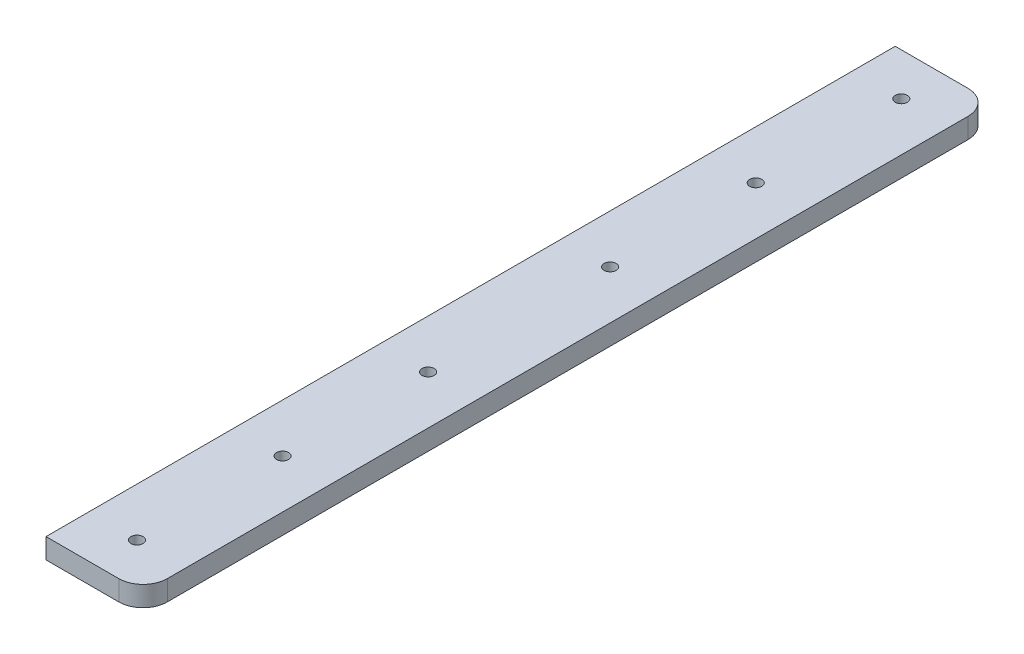
from build123d import *

# Parameters (mm, degrees)
SKETCH1_R           = 1.5
BOSS_EXTRUDE1_DEPTH = 5


with BuildPart() as part:
    # Sketch1 → Boss-Extrude1 (new body)
    with BuildSketch(Plane(origin=(0, 0, 0), x_dir=(1, 0, 0), z_dir=(0, 1, 0))):
        with BuildLine():
            Line((-12, -105), (-12, 105))
            Line((-12, 105), (6, 105))
            ThreePointArc((6, 105), (10.242640687, 103.242640687), (12, 99))
            Line((12, 99), (12, -99))
            ThreePointArc((12, -99), (10.242640687, -103.242640687), (6, -105))
            Line((6, -105), (-12, -105))
        make_face()
        with Locations((0, -94.5)):
            Circle(SKETCH1_R, mode=Mode.SUBTRACT)
        with Locations((0, -58.5)):
            Circle(SKETCH1_R, mode=Mode.SUBTRACT)
        with Locations((0, -22.5)):
            Circle(SKETCH1_R, mode=Mode.SUBTRACT)
        with Locations((0, 94.5)):
            Circle(SKETCH1_R, mode=Mode.SUBTRACT)
        with Locations((0, 58.5)):
            Circle(SKETCH1_R, mode=Mode.SUBTRACT)
        with Locations((0, 22.5)):
            Circle(SKETCH1_R, mode=Mode.SUBTRACT)
    extrude(amount=BOSS_EXTRUDE1_DEPTH)


solid = part.part
